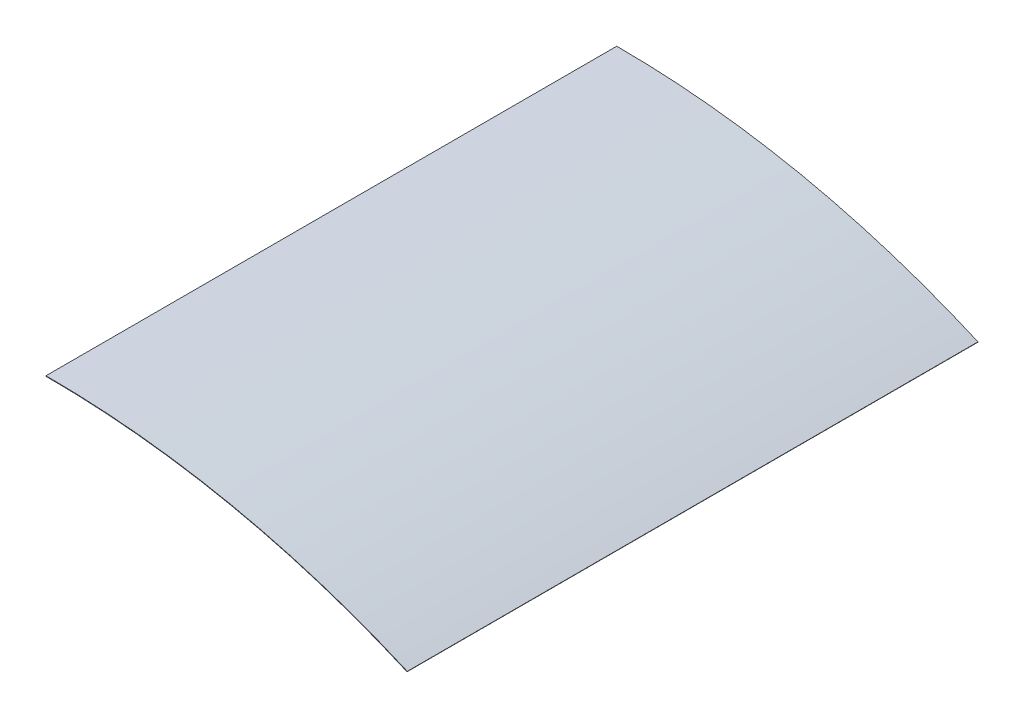
from build123d import *

# Parameters (mm, degrees)
ODGI_CIE_BAZOWE2_DEPTH = 5460


# Sheet-metal steps are written as plain solids
with BuildPart() as part:
    # Szkic9 → Odgięcie bazowe2 (new body)
    with BuildSketch(Plane.XY):
        with BuildLine():
            ThreePointArc((0, 0), (1765.235321475, -182.249456279), (3456, -721.309199116))
            Line((3456, -721.309199116), (3454, -725.891774811))
            ThreePointArc((3454, -725.891774811), (1764.213773256, -187.143987843), (0, -5))
            Line((0, -5), (0, 0))
        make_face()
    extrude(amount=-ODGI_CIE_BAZOWE2_DEPTH)


solid = part.part
